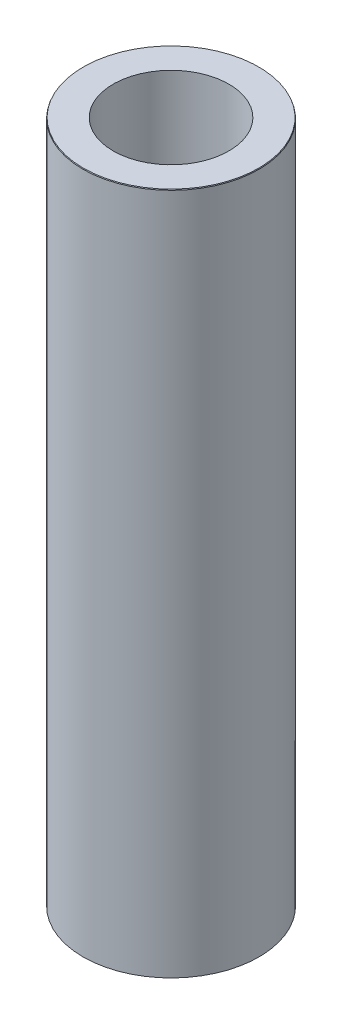
from build123d import *
from OCP.BRepFilletAPI import BRepFilletAPI_MakeChamfer

# Parameters (mm, degrees)
SKETCH1_R           = 22.5
BOSS_EXTRUDE1_DEPTH = 174.669504838
SKETCH2_R           = 14.798047754
CUT_EXTRUDE1_DEPTH  = 178.544180193
CHAMFER1_SIZE       = 0.21490375
CHAMFER1_SIZE2      = 0.08188216


with BuildPart() as part:
    # Sketch1 → Boss-Extrude1 (new body)
    with BuildSketch(Plane(origin=(0, 0, 0), x_dir=(1, 0, 0), z_dir=(0, 1, 0))):
        Circle(SKETCH1_R)
    extrude(amount=BOSS_EXTRUDE1_DEPTH)

    # Sketch2 → Cut-Extrude1 (cut, through all)
    with BuildSketch(Plane(origin=(0, 0, 0), x_dir=(1, 0, 0), z_dir=(0, 1, 0))):
        Circle(SKETCH2_R)
    extrude(amount=CUT_EXTRUDE1_DEPTH, mode=Mode.SUBTRACT)

    # Chamfer1: one chamfer whose edges measure the first distance from different faces: ONE call of the kernel's chamfer builder (chamfer() names one face for all edges)
    chamfer1_edges_1 = [part.edges().sort_by_distance(p)[0] for p in [
        (-22.5, 174.669504838, 0),
    ]]
    chamfer1_side_1 = [part.faces().sort_by_distance(p)[0] for p in [
        (-22.5, 87.334752419, 0),
    ]]
    chamfer1_edges_2 = [part.edges().sort_by_distance(p)[0] for p in [
        (-22.5, 0, 0),
    ]]
    chamfer1_side_2 = [part.faces().sort_by_distance(p)[0] for p in [
        (-21.863603897, 0, 0),
    ]]
    chamfer1 = BRepFilletAPI_MakeChamfer(part.part.solid().wrapped)
    for e in chamfer1_edges_1:
        chamfer1.Add(CHAMFER1_SIZE, CHAMFER1_SIZE2, e.wrapped, chamfer1_side_1[0].wrapped)  # the first distance lies on this face
    for e in chamfer1_edges_2:
        chamfer1.Add(CHAMFER1_SIZE, CHAMFER1_SIZE2, e.wrapped, chamfer1_side_2[0].wrapped)  # the first distance lies on this face
    add(Compound.cast(chamfer1.Shape()), mode=Mode.REPLACE)


solid = part.part
